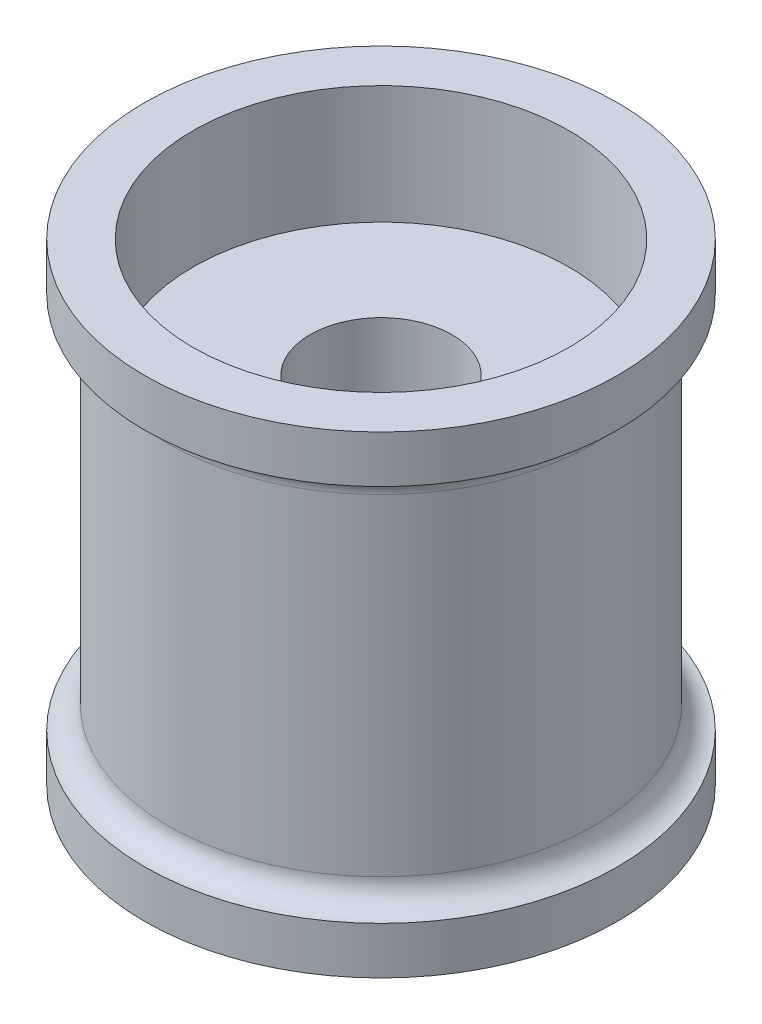
from build123d import *

# Parameters (mm, degrees)
SKETCH_1_R          = 8
SKETCH_1_R_2        = 3
EXTRUDE_1_DEPTH     = 20
EXTRUDE_START       = -20
SKETCH_2_R          = 9
SKETCH_2_R_2        = 3
EXTRUDE_2_DEPTH     = 20
EXTRUDE_START_2     = -2
SKETCH_3_R          = 10
SKETCH_3_R_2        = 9
EXTRUDE_3_DEPTH     = 2
FILLET_1_R          = 1
FILLET_2_R          = 1
SKETCH_4_R          = 7.95
CUT_EXTRUDE_1_DEPTH = 5
CUT_EXTRUDE_START   = -5
SKETCH_5_R          = 7.95
CUT_EXTRUDE_2_DEPTH = 5


with BuildPart() as part:
    # 草图1 → 凸台-拉伸1 (new body)
    with BuildSketch(Plane(origin=(0, 0, 0), x_dir=(1, 0, 0), z_dir=(0, 1, 0))):
        with Locations(Location((0, 0, 0), (0, 0, 270))):
            Circle(SKETCH_1_R)
        with Locations(Location((0, 0, 0), (0, 0, 270))):
            Circle(SKETCH_1_R_2, mode=Mode.SUBTRACT)
    extrude(amount=EXTRUDE_1_DEPTH)

    # 草图2 → 凸台-拉伸2 (add)
    with BuildSketch(Plane(origin=(0, 20, 0), x_dir=(1, 0, 0), z_dir=(0, 1, 0)).offset(EXTRUDE_START)):
        with Locations(Location((0, 0, 0), (0, 0, 270))):
            Circle(SKETCH_2_R)
        with Locations(Location((0, 0, 0), (0, 0, 270))):
            Circle(SKETCH_2_R_2, mode=Mode.SUBTRACT)
    extrude(amount=EXTRUDE_2_DEPTH)

    # 草图3 → 凸台-拉伸3 (add)
    with BuildSketch(Plane(origin=(0, 20, 0), x_dir=(1, 0, 0), z_dir=(0, 1, 0)).offset(EXTRUDE_START_2)):
        with Locations(Location((0, 0, 0), (0, 0, 270))):
            Circle(SKETCH_3_R)
        with Locations(Location((0, 0, 0), (0, 0, 270))):
            Circle(SKETCH_3_R_2, mode=Mode.SUBTRACT)
    extrude_3 = extrude(amount=EXTRUDE_3_DEPTH)

    # 镜向1: 凸台-拉伸3 across plane
    add(extrude_3.mirror(Plane(origin=(0, 10, 0), x_dir=(0, 0, 1), z_dir=(0, -1, 0))))

    # 圆角1
    fillet_1_edges = [part.edges().sort_by_distance(p)[0] for p in [
        (0, 18, -9),
    ]]
    fillet(fillet_1_edges, radius=FILLET_1_R - 0.0001)  # a hair under: the kernel refuses the full size

    # 圆角2
    fillet_2_edges = [part.edges().sort_by_distance(p)[0] for p in [
        (0, 2, -9),
    ]]
    fillet(fillet_2_edges, radius=FILLET_2_R - 0.0001)  # a hair under: the kernel refuses the full size

    # 草图4 → 切除-拉伸1 (cut)
    with BuildSketch(Plane.XZ):
        with Locations(Location((0, 0, 0), (0, 0, 270))):
            Circle(SKETCH_4_R)
    extrude(amount=-CUT_EXTRUDE_1_DEPTH, mode=Mode.SUBTRACT)

    # 草图5 → 切除-拉伸2 (cut)
    with BuildSketch(Plane(origin=(0, 20, 0), x_dir=(1, 0, 0), z_dir=(0, 1, 0)).offset(CUT_EXTRUDE_START)):
        with Locations(Location((0, 0, 0), (0, 0, 90))):
            Circle(SKETCH_5_R)
    extrude(amount=CUT_EXTRUDE_2_DEPTH, mode=Mode.SUBTRACT)


solid = part.part
